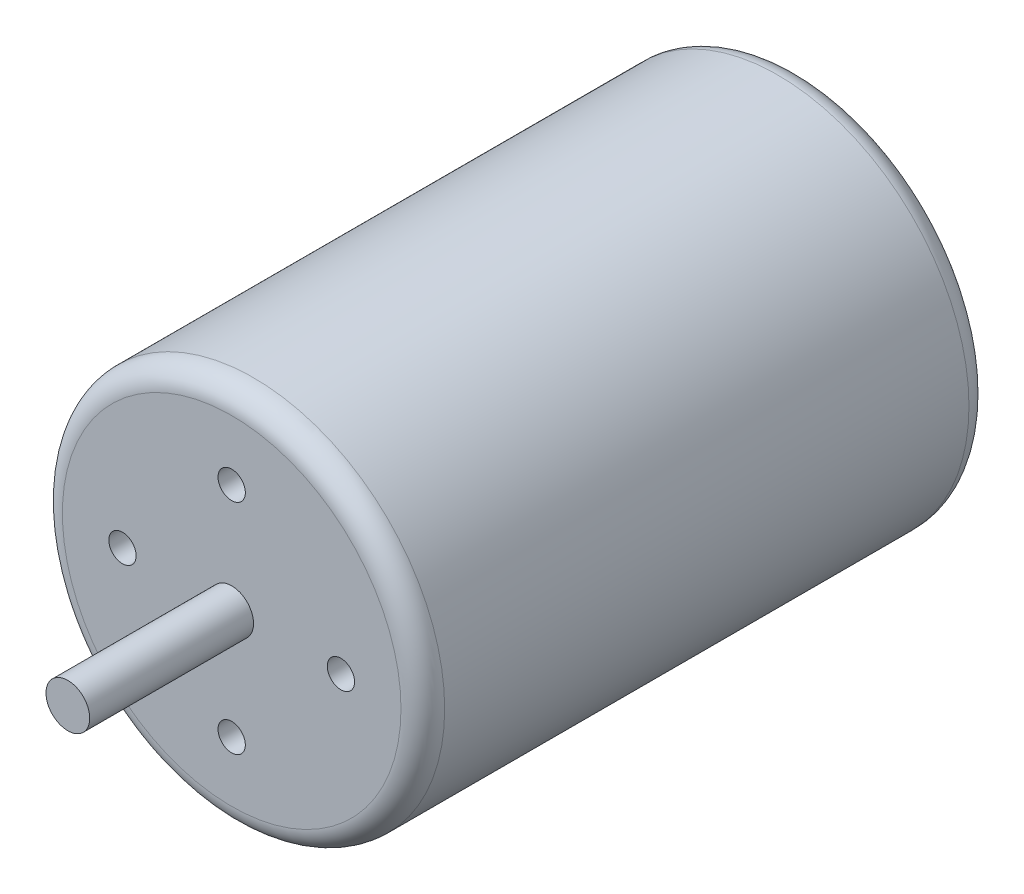
from build123d import *

# Parameters (mm, degrees)
SKETCH2_R           = 22.225
BOSS_EXTRUDE1_DEPTH = 66.04
SKETCH2_3_R         = 2.54
BOSS_EXTRUDE2_DEPTH = 19.05
FILLET1_R           = 2.54
SKETCH3_R           = 1.5875
CUT_EXTRUDE1_DEPTH  = 6.35


with BuildPart() as part:
    # Sketch2 → Boss-Extrude1 (new body)
    with BuildSketch(Plane.XY):
        Circle(SKETCH2_R)
    extrude(amount=-BOSS_EXTRUDE1_DEPTH)

    # Sketch2<3> → Boss-Extrude2 (add)
    with BuildSketch(Plane.XY):
        Circle(SKETCH2_3_R)
    extrude(amount=BOSS_EXTRUDE2_DEPTH)

    # Fillet1
    fillet1_edges = [part.edges().sort_by_distance(p)[0] for p in [
        (-22.225, 0, 0),
        (-22.225, 0, -66.04),
    ]]
    fillet(fillet1_edges, radius=FILLET1_R)

    # Sketch3 → Cut-Extrude1 (cut)
    with BuildSketch(Plane.XY):
        with Locations((0, 12.7)):
            Circle(SKETCH3_R)
        with Locations((12.7, 0)):
            Circle(SKETCH3_R)
        with Locations((0, -12.7)):
            Circle(SKETCH3_R)
        with Locations((-12.7, 0)):
            Circle(SKETCH3_R)
    extrude(amount=-CUT_EXTRUDE1_DEPTH, mode=Mode.SUBTRACT)


solid = part.part
